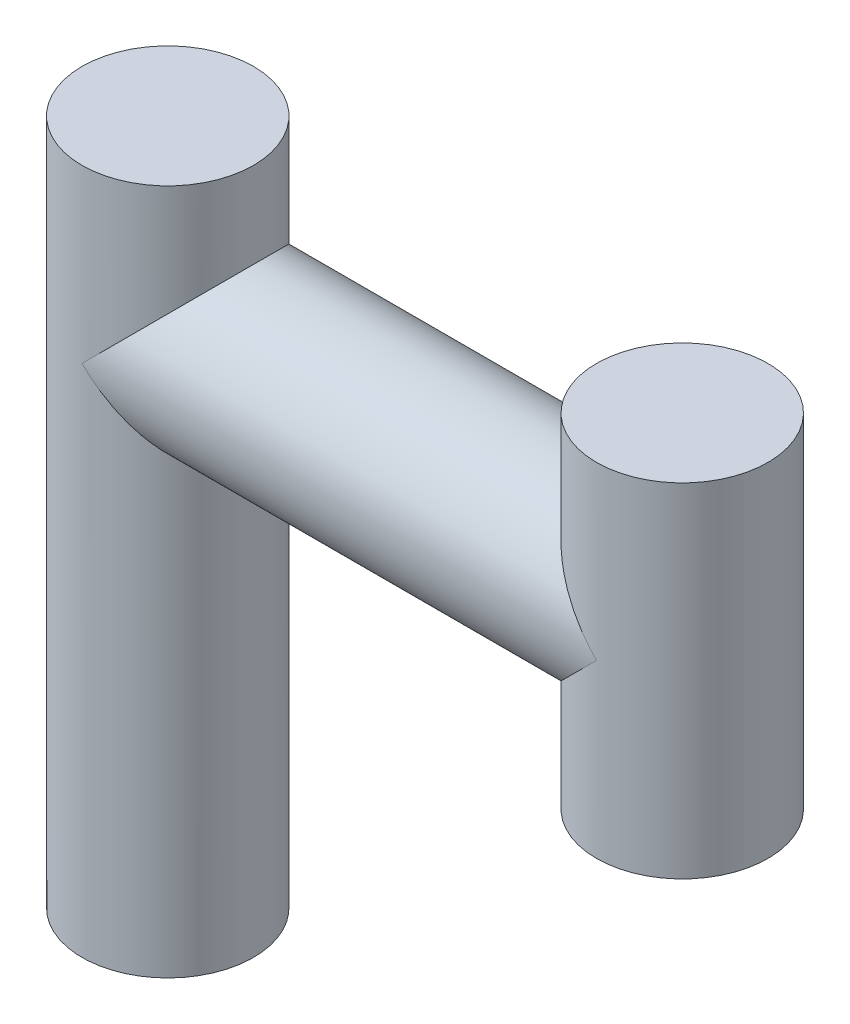
from build123d import *

# Parameters (mm, degrees)
SKETCH2_R           = 2.5
BOSS_EXTRUDE2_DEPTH = 10
SKETCH3_R           = 2.5
BOSS_EXTRUDE3_DEPTH = 7.5
BOSS_EXTRUDE4_START = 10
SKETCH4_R           = 2.5
BOSS_EXTRUDE4_DEPTH = 10


with BuildPart() as part:
    # Sketch2 → Boss-Extrude2 (new body)
    with BuildSketch(Plane(origin=(0, 0, 0), x_dir=(1, 0, 0), z_dir=(0, 1, 0))):
        Circle(SKETCH2_R)
    boss_extrude2 = extrude(amount=BOSS_EXTRUDE2_DEPTH)

    # Sketch3 → Boss-Extrude3 (add)
    with BuildSketch(Plane(origin=(0, 0, 0), x_dir=(0, 0, -1), z_dir=(1, 0, 0))):
        with Locations((0, 5)):
            Circle(SKETCH3_R)
    boss_extrude3 = extrude(amount=BOSS_EXTRUDE3_DEPTH)

    # Mirror5: Boss-Extrude2, Boss-Extrude3 across plane
    add(boss_extrude2.mirror(Plane(origin=(7.5, 5, 0), x_dir=(0, 0, 1), z_dir=(1, 0, 0))))
    add(boss_extrude3.mirror(Plane(origin=(7.5, 5, 0), x_dir=(0, 0, 1), z_dir=(1, 0, 0))))

    # Sketch4 → Boss-Extrude4 (add)
    with BuildSketch(Plane.XZ.offset(BOSS_EXTRUDE4_START)):
        Circle(SKETCH4_R)
    extrude(amount=-BOSS_EXTRUDE4_DEPTH)


solid = part.part
